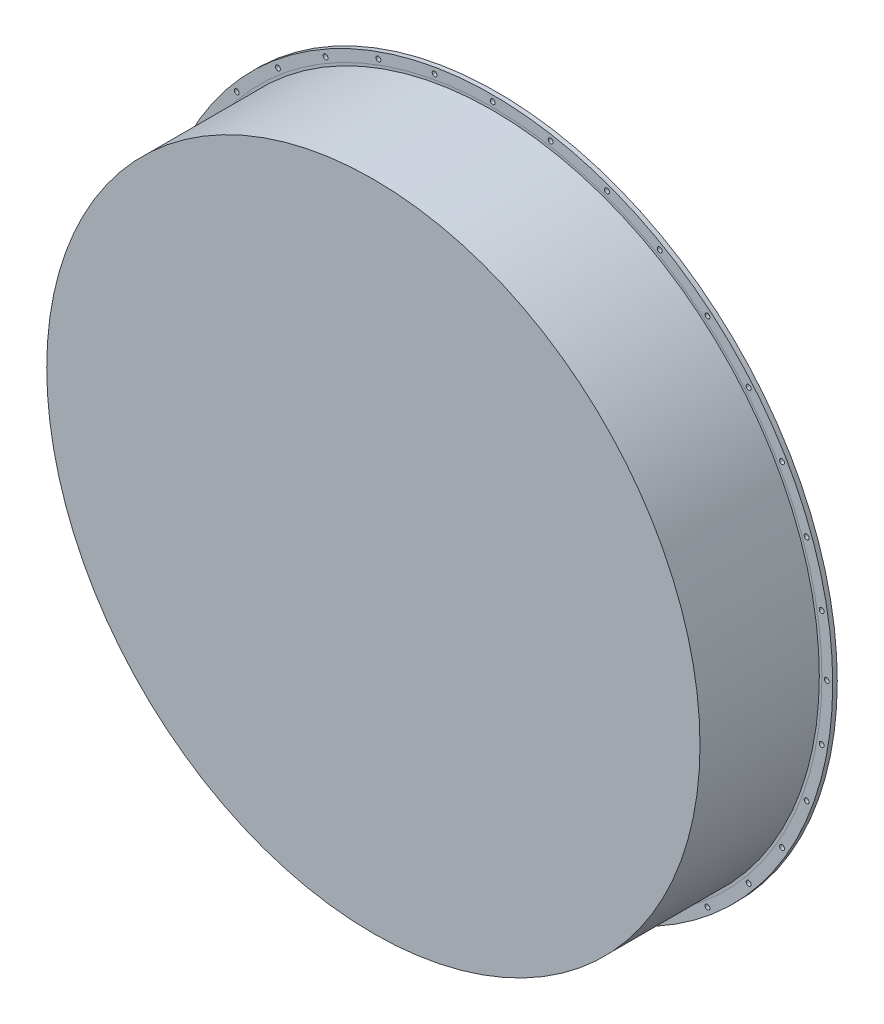
from build123d import *
from build123d.topology import SkipClean

# Parameters (mm, degrees)
SKETCH2_W                           = 28.237500084
SKETCH2_H                           = 9.525
SKETCH4_R                           = 682
CUT_EXTRUDE_CLEAR_BOTTOM_FACE_DEPTH = 12.7
SKETCH6_W                           = 5.15874
SKETCH6_H                           = 9.525
CIRPATTERN_36X_COUNT                = 36


# Read off the part's stored shape, not the designer's step: Extrude-Thin - Walls_Cap Ends
with BuildPart() as part:
    # Sketch2 → Revolve1 (revolve)
    with BuildSketch(Plane(origin=(0, 0, 0), x_dir=(1, 0, 0), z_dir=(0, 1, 0)), mode=Mode.PRIVATE) as revolve1_sk:
        with Locations((-700.881249958, -4.7625)):
            Rectangle(SKETCH2_W, SKETCH2_H)
    revolve(revolve1_sk.sketch.rotate(Axis((0, 0, 67.7), (0, 0, -1)), 180), axis=Axis((0, 0, 67.7), (0, 0, -1)))

    # Sketch6 → 3/8 Clearance Hole for Clamping Ring (revolve, cut)
    with BuildSketch(Plane(origin=(-702.5, 0, 9.525), x_dir=(0, -1, 0), z_dir=(1, 0, 0))):
        with Locations((2.57937, 4.7625)):
            Rectangle(SKETCH6_W, SKETCH6_H)
    f_3_8_clearance_hole_for_clamping_ring = revolve(axis=Axis((-702.5, 0, 15.875), (0, 0, -1)), mode=Mode.SUBTRACT)

    # CirPattern - 36X: 3/8 Clearance Hole for Clamping Ring ×36 about axis
    cirpattern_36x_axis = Axis((0, 0, 0), (0, 0, 1))
    for i in range(1, CIRPATTERN_36X_COUNT):
        add(f_3_8_clearance_hole_for_clamping_ring.rotate(cirpattern_36x_axis, i * 360 / CIRPATTERN_36X_COUNT), mode=Mode.SUBTRACT)


with BuildPart() as body_2:
    # Extrude-Thin - Walls_Cap Ends outline → Extrude-Thin - Walls_Cap Ends (revolve)
    with BuildSketch(Plane.XZ):
        Polygon((686.762499916, 260.35), (0, 260.35), (0, 257.175), (681.999999916, 257.175), (681.999999916, 3.175), (0, 3.175), (0, 0), (686.762499916, 0), align=None)
    revolve(axis=Axis((0, 0, 0), (0, 0, 1)))

    # Sketch4 → Cut-Extrude - Clear Bottom Face (cut)
    with SkipClean():  # the faces are left unmerged after this step: merging them gives an invalid solid
        with BuildSketch(Plane(origin=(0, 0, 0), x_dir=(-1, 0, 0), z_dir=(0, 0, -1))):
            Circle(SKETCH4_R)
        extrude(amount=-CUT_EXTRUDE_CLEAR_BOTTOM_FACE_DEPTH, mode=Mode.SUBTRACT)


solid = Compound([part.part, body_2.part])
